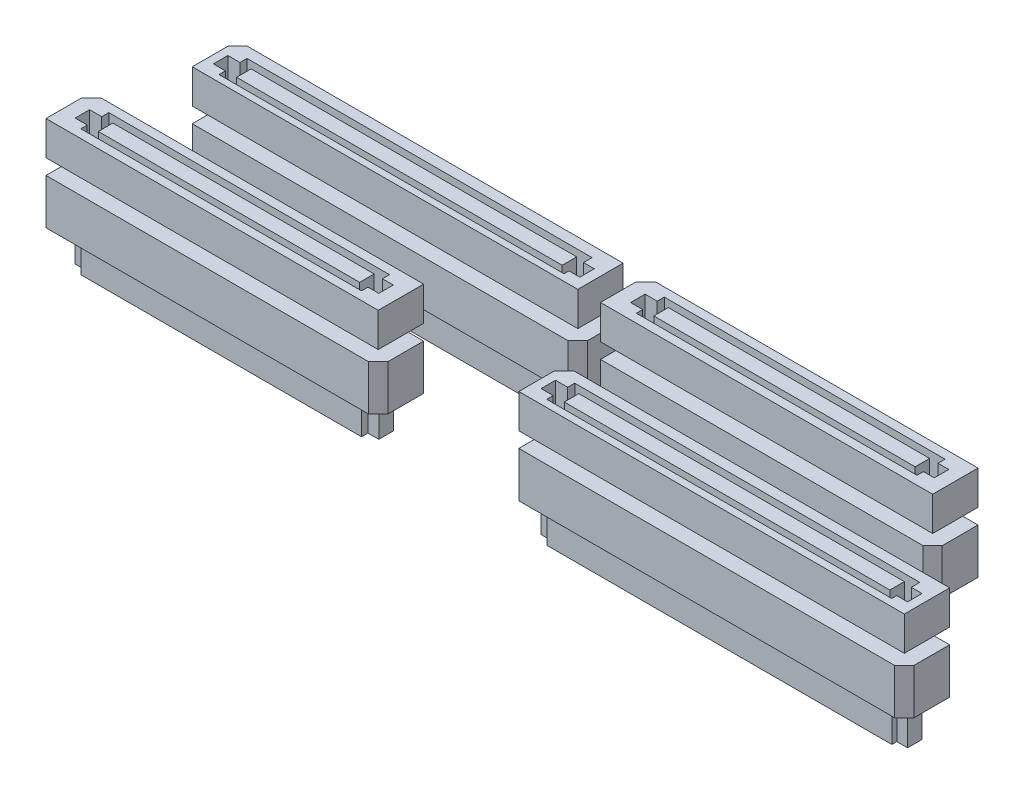
from build123d import *

# Parameters (mm, degrees)
SV_DEPTH           = 3.75
SV_2_DEPTH         = 3.75
SV_3_DEPTH         = 3.75
SV_4_DEPTH         = 3.75
SKETCH3_W          = 28.811718275
SKETCH3_H          = 1.597828601
SKETCH3_W_2        = 35.897762959
SKETCH3_W_3        = 35.897762958
CUT_EXTRUDE1_DEPTH = 3.5
SV4_A_DEPTH        = 5
SV4_A_2_DEPTH      = 5
SV4_A_3_DEPTH      = 5
SV4_A_4_DEPTH      = 5
SKETCH7_W          = 35.897762958
SKETCH7_H          = 1.597828601
SKETCH7_W_2        = 28.811718275
SKETCH7_W_3        = 35.897762959
SV4_B_DEPTH        = 3.5


with BuildPart() as part:
    # Sketch1 → SV (new body)
    with BuildSketch(Plane(origin=(0, 0, 0), x_dir=(1, 0, 0), z_dir=(0, 1, 0))):
        Polygon((55.811, 9.5), (97.25, 9.5), (97.25, 5.56), (97.25, 4.5), (96.19, 4.5), (54.75, 4.5), (54.75, 8.439), align=None)
    extrude(amount=SV_DEPTH)


with BuildPart() as body_2:
    # Sketch1 → SV 2 (new body)
    with BuildSketch(Plane(origin=(0, 0, 0), x_dir=(1, 0, 0), z_dir=(0, 1, 0))):
        Polygon((3.686, 9.5), (39.25, 9.5), (39.25, 5.555), (39.25, 4.5), (38.195, 4.5), (2.625, 4.5), (2.625, 8.439), align=None)
    extrude(amount=SV_2_DEPTH)


with BuildPart() as body_3:
    # Sketch1 → SV 3 (new body)
    with BuildSketch(Plane(origin=(0, 0, 0), x_dir=(1, 0, 0), z_dir=(0, 1, 0))):
        Polygon((51.811, 22.5), (87.375, 22.5), (87.375, 18.555), (87.375, 17.5), (86.32, 17.5), (50.75, 17.5), (50.75, 21.439), align=None)
    extrude(amount=SV_3_DEPTH)


with BuildPart() as body_4:
    # Sketch1 → SV 4 (new body)
    with BuildSketch(Plane(origin=(0, 0, 0), x_dir=(1, 0, 0), z_dir=(0, 1, 0))):
        Polygon((6.811, 22.5), (48.25, 22.5), (48.25, 18.56), (48.25, 17.5), (47.19, 17.5), (5.75, 17.5), (5.75, 21.439), align=None)
    extrude(amount=SV_4_DEPTH)


with BuildPart() as cut_extrude1_tool:
    # Sketch3 → Cut-Extrude1 (new body)
    # profile 1 of 4: a face of its own
    with BuildSketch(Plane(origin=(0, 3.75, 0), x_dir=(1, 0, 0), z_dir=(0, 1, 0))):
        Polygon((4.189336253, 7.745735487), (5.524337048, 7.745735487), (5.524337048, 8.524173538), (36.475691419, 8.524173538), (36.475691419, 7.745735487), (37.666991912, 7.745735487), (37.666991912, 6.147906886), (36.475691419, 6.147906886), (36.475691419, 5.438560322), (5.524337048, 5.438560322), (5.524337048, 6.147906886), (4.189336253, 6.147906886), align=None)
        with Locations((21.152985591, 6.946821187)):
            Rectangle(SKETCH3_W, SKETCH3_H, mode=Mode.SUBTRACT)
    # profile 2 of 4: a face of its own
    with BuildSketch(Plane(origin=(0, 3.75, 0), x_dir=(1, 0, 0), z_dir=(0, 1, 0))):
        Polygon((52.421116037, 20.753597434), (53.756116831, 20.753597434), (53.756116831, 21.532035485), (84.707471203, 21.532035485), (84.707471203, 20.753597434), (85.898771695, 20.753597434), (85.898771695, 19.155768833), (84.707471203, 19.155768833), (84.707471203, 18.446422269), (53.756116831, 18.446422269), (53.756116831, 19.155768833), (52.421116037, 19.155768833), align=None)
        with Locations((69.384765375, 19.954683133)):
            Rectangle(SKETCH3_W, SKETCH3_H, mode=Mode.SUBTRACT)
    # profile 3 of 4: a face of its own
    with BuildSketch(Plane(origin=(0, 3.75, 0), x_dir=(1, 0, 0), z_dir=(0, 1, 0))):
        Polygon((55.705906871, 7.599031898), (57.040907666, 7.599031898), (57.040907666, 8.377469948), (95.07830672, 8.377469948), (95.07830672, 7.437727621), (96.269607213, 7.437727621), (96.269607213, 5.83989902), (95.07830672, 5.83989902), (95.07830672, 5.291856733), (57.040907666, 5.291856733), (57.040907666, 6.001203297), (55.705906871, 6.001203297), align=None)
        with Locations((76.21257855, 6.800117597)):
            Rectangle(SKETCH3_W_2, SKETCH3_H, mode=Mode.SUBTRACT)
    # profile 4 of 4: a face of its own
    with BuildSketch(Plane(origin=(0, 3.75, 0), x_dir=(1, 0, 0), z_dir=(0, 1, 0))):
        Polygon((6.636601859, 20.53972103), (7.971602653, 20.53972103), (7.971602653, 21.318159081), (46.009001708, 21.318159081), (46.009001708, 20.378416754), (47.2003022, 20.378416754), (47.2003022, 18.780588153), (46.009001708, 18.780588153), (46.009001708, 18.232545866), (7.971602653, 18.232545866), (7.971602653, 18.941892429), (6.636601859, 18.941892429), align=None)
        with Locations((27.143273538, 19.74080673)):
            Rectangle(SKETCH3_W_3, SKETCH3_H, mode=Mode.SUBTRACT)
    extrude(amount=-CUT_EXTRUDE1_DEPTH)


with BuildPart() as part_1:
    add(part.part)

    # Cut-Extrude1: cut by cut_extrude1_tool
    add(cut_extrude1_tool.part, mode=Mode.SUBTRACT)


with BuildPart() as body_2_1:
    add(body_2.part)

    # Cut-Extrude1: cut by cut_extrude1_tool
    add(cut_extrude1_tool.part, mode=Mode.SUBTRACT)


with BuildPart() as body_3_1:
    add(body_3.part)

    # Cut-Extrude1: cut by cut_extrude1_tool
    add(cut_extrude1_tool.part, mode=Mode.SUBTRACT)


with BuildPart() as body_4_1:
    add(body_4.part)

    # Cut-Extrude1: cut by cut_extrude1_tool
    add(cut_extrude1_tool.part, mode=Mode.SUBTRACT)


with BuildPart() as body_5:
    # Sketch6 → SV4(a) (new body)
    with BuildSketch(Plane(origin=(0, -1.68656, 0), x_dir=(1, 0, 0), z_dir=(0, 1, 0))):
        Polygon((2.625, 4.5), (38.195, 4.5), (39.25, 5.555), (39.25, 9.5), (3.685, 9.5), (2.625, 9.5), (2.625, 8.44), align=None)
    extrude(amount=-SV4_A_DEPTH)



with BuildPart() as body_6:
    # Sketch6 → SV4_a 2 (new body)
    with BuildSketch(Plane(origin=(0, -1.68656, 0), x_dir=(1, 0, 0), z_dir=(0, 1, 0))):
        Polygon((48.25, 18.56191605), (47.18808395, 17.5), (5.75, 17.5), (5.75, 21.44), (5.75, 22.5), (6.81, 22.5), (48.25, 22.5), align=None)
    extrude(amount=-SV4_A_2_DEPTH)


with BuildPart() as body_7:
    # Sketch6 → SV4_a 3 (new body)
    with BuildSketch(Plane(origin=(0, -1.68656, 0), x_dir=(1, 0, 0), z_dir=(0, 1, 0))):
        Polygon((54.75, 4.5), (96.19, 4.5), (97.25, 5.56), (97.25, 9.5), (55.81, 9.5), (54.75, 9.5), (54.75, 8.44), align=None)
    extrude(amount=-SV4_A_3_DEPTH)


with BuildPart() as body_8:
    # Sketch6 → SV4_a 4 (new body)
    with BuildSketch(Plane(origin=(0, -1.68656, 0), x_dir=(1, 0, 0), z_dir=(0, 1, 0))):
        Polygon((50.75, 17.5), (86.32, 17.5), (87.375, 18.555), (87.375, 22.5), (51.805, 22.5), (50.75, 22.5), (50.75, 21.445), align=None)
    extrude(amount=-SV4_A_4_DEPTH)


with BuildPart() as body_5_1:
    add(body_5.part)

    add(body_6.part)  # SV4(b) merges body 6

    add(body_7.part)  # SV4(b) merges body 7

    add(body_8.part)  # SV4(b) merges body 8
    # Sketch7 → SV4(b) (add)
    # profile 1 of 4: a face of its own
    with BuildSketch(Plane.XZ.offset(6.68656)):
        Polygon((7.971602653, -21.318159081), (7.971602653, -20.53972103), (6.636601859, -20.53972103), (6.636601859, -18.941892429), (7.971602653, -18.941892429), (7.971602653, -18.232545866), (46.009001708, -18.232545866), (46.009001708, -18.780588153), (47.2003022, -18.780588153), (47.2003022, -20.378416754), (46.009001708, -20.378416754), (46.009001708, -21.318159081), align=None)
        with Locations((27.143273538, -19.74080673)):
            Rectangle(SKETCH7_W, SKETCH7_H, mode=Mode.SUBTRACT)
    # profile 2 of 4: a face of its own
    with BuildSketch(Plane.XZ.offset(6.68656)):
        Polygon((53.756116831, -21.532035485), (84.707471203, -21.532035485), (84.707471203, -20.753597434), (85.898771695, -20.753597434), (85.898771695, -19.155768833), (84.707471203, -19.155768833), (84.707471203, -18.446422269), (53.756116831, -18.446422269), (53.756116831, -19.155768833), (52.421116037, -19.155768833), (52.421116037, -20.753597434), (53.756116831, -20.753597434), align=None)
        with Locations((69.384765375, -19.954683133)):
            Rectangle(SKETCH7_W_2, SKETCH7_H, mode=Mode.SUBTRACT)
    # profile 3 of 4: a face of its own
    with BuildSketch(Plane.XZ.offset(6.68656)):
        Polygon((57.040907666, -8.377469948), (57.040907666, -7.599031898), (55.705906871, -7.599031898), (55.705906871, -6.001203297), (57.040907666, -6.001203297), (57.040907666, -5.291856733), (95.07830672, -5.291856733), (95.07830672, -5.83989902), (96.269607213, -5.83989902), (96.269607213, -7.437727621), (95.07830672, -7.437727621), (95.07830672, -8.377469948), align=None)
        with Locations((76.21257855, -6.800117597)):
            Rectangle(SKETCH7_W_3, SKETCH7_H, mode=Mode.SUBTRACT)
    # profile 4 of 4: a face of its own
    with BuildSketch(Plane.XZ.offset(6.68656)):
        Polygon((4.189336253, -6.147906886), (5.524337048, -6.147906886), (5.524337048, -5.438560322), (36.475691419, -5.438560322), (36.475691419, -6.147906886), (37.666991912, -6.147906886), (37.666991912, -7.745735487), (36.475691419, -7.745735487), (36.475691419, -8.524173538), (5.524337048, -8.524173538), (5.524337048, -7.745735487), (4.189336253, -7.745735487), align=None)
        with Locations((21.152985591, -6.946821187)):
            Rectangle(SKETCH7_W_2, SKETCH7_H, mode=Mode.SUBTRACT)
    extrude(amount=SV4_B_DEPTH)


solid = Compound([part_1.part, body_2_1.part, body_3_1.part, body_4_1.part, body_5_1.part])
